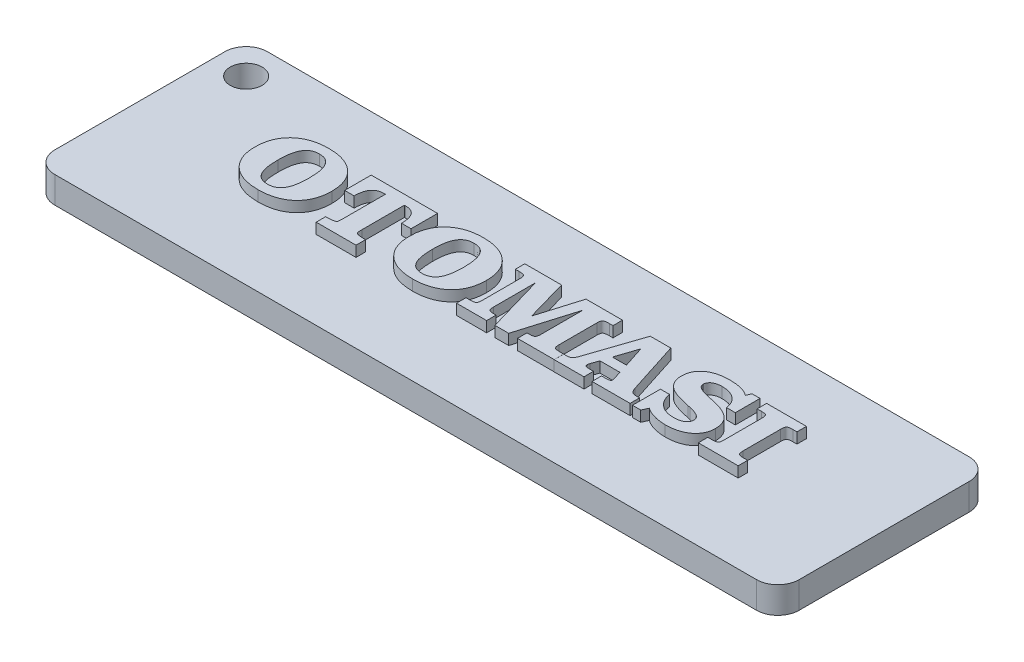
from build123d import *

# Parameters (mm, degrees)
SKETCH1_R           = 1.5
BOSS_EXTRUDE1_DEPTH = 2.5
BOSS_EXTRUDE2_DEPTH = 1


# Read off the part's stored shape, not the designer's step: Boss-Extrude2
with BuildPart() as part:
    # Sketch1 → Boss-Extrude1 (new body)
    with BuildSketch(Plane(origin=(0, 0, 0), x_dir=(1, 0, 0), z_dir=(0, 1, 0))):
        with BuildLine():
            Line((2, 0), (68, 0))
            ThreePointArc((68, 0), (69.414213562, 0.585786438), (70, 2))
            Line((70, 2), (70, 18))
            ThreePointArc((70, 18), (69.414213562, 19.414213562), (68, 20))
            Line((68, 20), (2, 20))
            ThreePointArc((2, 20), (0.585786438, 19.414213562), (0, 18))
            Line((0, 18), (0, 2))
            ThreePointArc((0, 2), (0.585786438, 0.585786438), (2, 0))
        make_face()
        with Locations(Location((3, 17, 0), (0, 0, 270))):
            Circle(SKETCH1_R, mode=Mode.SUBTRACT)
    extrude(amount=BOSS_EXTRUDE1_DEPTH)

    # Boss-Extrude2 outline → Boss-Extrude2 (add)
    # profile 1 of 7: a face of its own
    with BuildSketch(Plane(origin=(0, 2.5, 0), x_dir=(1, 0, 0), z_dir=(0, 1, 0))):
        with BuildLine():
            add(Edge.make_bspline(
                [(13.786930514, 7.318180924), (13.649802223, 7.320719924), (13.382310397, 7.325672672), (12.99274772, 7.368091793), (12.625803226, 7.437144678), (12.28129917, 7.53438664), (11.959554606, 7.660407631), (11.658986785, 7.811763921), (11.38292109, 7.994590031), (11.130872946, 8.203580663), (10.903786646, 8.436124447), (10.708596373, 8.693047109), (10.540506944, 8.969238893), (10.406138537, 9.267900687), (10.299250251, 9.586060568), (10.224796832, 9.925186783), (10.179646328, 10.284904318), (10.173964081, 10.531695195), (10.171052157, 10.658165672)],
                knots=[0, 0, 0, 0, 0.073749299, 0.143860428, 0.210503597, 0.274407664, 0.336117077, 0.396122131, 0.455094583, 0.513829434, 0.571961739, 0.629530751, 0.687035205, 0.745512812, 0.805324045, 0.867275774, 0.93198413, 1, 1, 1, 1], degree=3))
            add(Edge.make_bspline(
                [(17.394448458, 10.658165672), (17.391552518, 10.531231476), (17.385911539, 10.283977343), (17.340656321, 9.923324408), (17.266034008, 9.583991521), (17.161145628, 9.264817279), (17.026192845, 8.966553838), (16.858822394, 8.690331526), (16.662623515, 8.435051613), (16.43747285, 8.202301419), (16.18710719, 7.992450552), (15.910035696, 7.812825565), (15.612377335, 7.658189243), (15.290372267, 7.534699861), (14.946726976, 7.436999778), (14.58015267, 7.368254618), (14.191100181, 7.325587537), (13.92406269, 7.32069394), (13.786930514, 7.318180924)],
                knots=[0, 0, 0, 0, 0.068331593, 0.133102578, 0.195358385, 0.255148577, 0.313682782, 0.371242893, 0.42866919, 0.486683902, 0.545283253, 0.604175403, 0.664130134, 0.725575403, 0.78954132, 0.856248991, 0.926179321, 1, 1, 1, 1], degree=3))
            add(Edge.make_bspline(
                [(13.786930514, 14.006510832), (13.923599449, 14.004005939), (14.189712823, 13.999128565), (14.577819956, 13.956308658), (14.94348838, 13.887799281), (15.286938621, 13.790153464), (15.60781127, 13.664672009), (15.906392474, 13.510863804), (16.18265614, 13.328856513), (16.434607963, 13.119678684), (16.661717109, 12.887183494), (16.856911008, 12.630251301), (17.024963287, 12.35404965), (17.159661456, 12.055035464), (17.266193124, 11.735804014), (17.34085597, 11.394872343), (17.385763071, 11.033266603), (17.391509397, 10.785096653), (17.394448458, 10.658165672)],
                knots=[0, 0, 0, 0, 0.073507035, 0.143128393, 0.209778313, 0.273448551, 0.334931585, 0.394834411, 0.453812837, 0.512553638, 0.570691833, 0.628266677, 0.685776956, 0.744260487, 0.804314784, 0.866516694, 0.931727564, 1, 1, 1, 1], degree=3))
            add(Edge.make_bspline(
                [(10.171052157, 10.658165672), (10.173978074, 10.785096617), (10.179688072, 11.032805443), (10.224597118, 11.393506817), (10.299555265, 11.733413009), (10.405727295, 12.052313429), (10.54103736, 12.351408308), (10.707616681, 12.628615438), (10.904798862, 12.884463505), (11.130313326, 13.118354924), (11.38290146, 13.327445624), (11.659729167, 13.509597649), (11.958744058, 13.664941675), (12.281415659, 13.790076774), (12.62577011, 13.887611992), (12.992757214, 13.956581352), (13.382307826, 13.999024123), (13.649801352, 14.00397354), (13.786930514, 14.006510832)],
                knots=[0, 0, 0, 0, 0.068186534, 0.13306768, 0.194947727, 0.254926463, 0.313336408, 0.370988088, 0.428292477, 0.48653691, 0.545203802, 0.60410802, 0.664271826, 0.725909839, 0.789739965, 0.856306025, 0.926336032, 1, 1, 1, 1], degree=3))
        make_face()
        with BuildLine():
            add(Edge.make_bspline(
                [(13.785537111, 13.114733511), (13.723675316, 13.112715037), (13.603545379, 13.108795347), (13.429294201, 13.082664123), (13.268143536, 13.03676091), (13.12004326, 12.972048391), (12.984410603, 12.889258218), (12.863054495, 12.786658469), (12.754087049, 12.666419771), (12.659001855, 12.526960494), (12.576837775, 12.366914808), (12.504211679, 12.187103212), (12.445817327, 11.985019849), (12.394782272, 11.762884694), (12.358862575, 11.518153235), (12.330904599, 11.252291634), (12.314250278, 10.964459985), (12.31231882, 10.765479369), (12.311317727, 10.662345878)],
                knots=[0, 0, 0, 0, 0.05712815, 0.110937632, 0.16225665, 0.21142799, 0.259761507, 0.308476094, 0.35767175, 0.409189365, 0.463868863, 0.523528719, 0.587991329, 0.657919281, 0.733872173, 0.816247885, 0.904759581, 1, 1, 1, 1], degree=3))
            add(Edge.make_bspline(
                [(15.254182887, 10.662345878), (15.253181796, 10.765479371), (15.25125034, 10.96445999), (15.234596002, 11.252291619), (15.206638083, 11.518153288), (15.170718199, 11.76288452), (15.119683762, 11.985020423), (15.061287365, 12.18710131), (14.988668045, 12.36692111), (14.906481511, 12.526939612), (14.811472844, 12.666491539), (14.702476013, 12.786141475), (14.582417445, 12.889743712), (14.447090151, 12.971616076), (14.300222699, 13.036820955), (14.139958179, 13.082826064), (13.966591605, 13.108696113), (13.846931827, 13.112686258), (13.785537111, 13.114733511)],
                knots=[0, 0, 0, 0, 0.095389312, 0.184039383, 0.266543876, 0.342615508, 0.412652782, 0.477216169, 0.536969294, 0.591734275, 0.643332429, 0.692604995, 0.741067421, 0.789476499, 0.838331509, 0.889317948, 0.943211553, 1, 1, 1, 1], degree=3))
            add(Edge.make_bspline(
                [(13.785537111, 8.209958245), (13.846931827, 8.212005498), (13.966591605, 8.215995643), (14.139958179, 8.241865692), (14.300222699, 8.287870802), (14.447090151, 8.35307568), (14.582417445, 8.434948044), (14.702476013, 8.538550281), (14.811472844, 8.658200217), (14.906481511, 8.797752144), (14.988668045, 8.957770646), (15.061287365, 9.137590446), (15.119683762, 9.339671333), (15.170718199, 9.561807236), (15.206638083, 9.806538468), (15.234596002, 10.072400137), (15.25125034, 10.360231767), (15.253181796, 10.559212385), (15.254182887, 10.662345878)],
                knots=[0, 0, 0, 0, 0.056788447, 0.110682052, 0.161668491, 0.210523501, 0.258932579, 0.307395005, 0.356667571, 0.408265725, 0.463030706, 0.522783831, 0.587347218, 0.657384492, 0.733456124, 0.815960617, 0.904610688, 1, 1, 1, 1], degree=3))
            add(Edge.make_bspline(
                [(12.311317727, 10.662345878), (12.31231882, 10.559212387), (12.314250278, 10.360231771), (12.330904599, 10.072400122), (12.358862575, 9.806538521), (12.394782272, 9.561807062), (12.445817327, 9.339671907), (12.504211679, 9.137588544), (12.576837775, 8.957776948), (12.659001855, 8.797731262), (12.754087049, 8.658271985), (12.863054495, 8.538033287), (12.984410603, 8.435433538), (13.12004326, 8.352643365), (13.268143536, 8.287930847), (13.429294201, 8.242027633), (13.603545379, 8.215896409), (13.723675316, 8.211976719), (13.785537111, 8.209958245)],
                knots=[0, 0, 0, 0, 0.095240419, 0.183752115, 0.266127827, 0.342080719, 0.412008671, 0.476471281, 0.536131137, 0.590810635, 0.64232825, 0.691523906, 0.740238493, 0.78857201, 0.83774335, 0.889062368, 0.94287185, 1, 1, 1, 1], degree=3))
        make_face(mode=Mode.SUBTRACT)
    # profile 2 of 7: a face of its own
    with BuildSketch(Plane(origin=(0, 2.5, 0), x_dir=(1, 0, 0), z_dir=(0, 1, 0))):
        with BuildLine():
            add(Edge.make_bspline(
                [(20.069780421, 12.936378047), (20.018609058, 12.935652352), (19.919114042, 12.934241347), (19.775157074, 12.913431467), (19.640827625, 12.88392484), (19.516852394, 12.840350761), (19.403762361, 12.78450621), (19.299948455, 12.717155229), (19.208185899, 12.635404348), (19.125064672, 12.542660202), (19.051679476, 12.437316313), (18.990979751, 12.317102687), (18.937979967, 12.184771234), (18.895175812, 12.039147125), (18.861664993, 11.880751877), (18.839154274, 11.709286241), (18.822632148, 11.524716445), (18.821749097, 11.397174279), (18.821292172, 11.331178869)],
                knots=[0, 0, 0, 0, 0.065836888, 0.128009921, 0.186918091, 0.242723212, 0.296756494, 0.349012631, 0.401565728, 0.45451556, 0.509102166, 0.56635027, 0.62754898, 0.692458291, 0.761553662, 0.835821997, 0.915047745, 1, 1, 1, 1], degree=3))
            Line((20.069780421, 12.936378047), (20.158958154, 12.936378047))
            Line((20.158958154, 12.936378047), (20.158958154, 8.930347112))
            add(Edge.make_bspline(
                [(20.015437741, 8.385526905), (20.028456477, 8.390793815), (20.054392067, 8.401286418), (20.085357892, 8.431382321), (20.111453264, 8.468330963), (20.129805419, 8.518593116), (20.143681015, 8.586463375), (20.151581396, 8.678012561), (20.159354666, 8.795523396), (20.159098914, 8.882485331), (20.158958154, 8.930347112)],
                knots=[0, 0, 0, 0, 0.070115796, 0.139682886, 0.213673683, 0.296662204, 0.406806644, 0.562099208, 0.758989816, 1, 1, 1, 1], degree=3))
            add(Edge.make_bspline(
                [(19.1780031, 8.299135977), (19.267202561, 8.300356706), (19.432254564, 8.302615506), (19.661304639, 8.314848724), (19.852668509, 8.340015463), (19.965048856, 8.371437812), (20.015437741, 8.385526905)],
                knots=[0, 0, 0, 0, 0.316723171, 0.586055041, 0.814396151, 1, 1, 1, 1], degree=3))
            Line((19.1780031, 8.299135977), (19.1780031, 7.407358656))
            Line((19.1780031, 7.407358656), (22.923467849, 7.407358656))
            Line((22.923467849, 7.407358656), (22.923467849, 8.299135977))
            add(Edge.make_bspline(
                [(22.091606817, 8.385526905), (22.128482749, 8.372813318), (22.212156751, 8.343965322), (22.332694716, 8.32776788), (22.456993677, 8.317270717), (22.585324152, 8.311186393), (22.744125783, 8.303709647), (22.860289836, 8.300747174), (22.923467849, 8.299135977)],
                knots=[0, 0, 0, 0, 0.139056308, 0.31552823, 0.432089724, 0.584950407, 0.774267444, 1, 1, 1, 1], degree=3))
            add(Edge.make_bspline(
                [(21.942512796, 8.938707525), (21.942308363, 8.889450032), (21.941937798, 8.800163208), (21.950306939, 8.680399066), (21.956480851, 8.587432245), (21.969672766, 8.518678556), (21.990092255, 8.468177939), (22.017554308, 8.431294658), (22.050251548, 8.40084117), (22.077631018, 8.390702281), (22.091606817, 8.385526905)],
                knots=[0, 0, 0, 0, 0.242693935, 0.43992029, 0.591647998, 0.701661426, 0.783731589, 0.857458003, 0.92723971, 1, 1, 1, 1], degree=3))
            Line((21.942512796, 8.938707525), (21.942512796, 12.936378047))
            Line((21.942512796, 12.936378047), (22.037264136, 12.936378047))
            add(Edge.make_bspline(
                [(23.280178778, 11.331178869), (23.279686182, 11.397169316), (23.278730741, 11.525164918), (23.262595505, 11.710260957), (23.239118331, 11.882374289), (23.208276001, 12.041678328), (23.16505684, 12.187185872), (23.111641399, 12.318868428), (23.051083872, 12.438345069), (22.979153108, 12.5438693), (22.897956808, 12.637346703), (22.804748717, 12.7168785), (22.702656072, 12.785704937), (22.590109743, 12.842353691), (22.465895337, 12.883449053), (22.331937525, 12.91357867), (22.187916844, 12.934201131), (22.088430857, 12.935638693), (22.037264136, 12.936378047)],
                knots=[0, 0, 0, 0, 0.085039263, 0.164942837, 0.239287238, 0.308918278, 0.37389407, 0.434599956, 0.491906694, 0.546210291, 0.598817214, 0.65103084, 0.703671823, 0.75722426, 0.812890466, 0.87185897, 0.934095681, 1, 1, 1, 1], degree=3))
            Line((23.280178778, 11.331178869), (24.171956099, 11.331178869))
            Line((24.171956099, 11.331178869), (24.171956099, 13.828155368))
            Line((24.171956099, 13.828155368), (17.929514851, 13.828155368))
            Line((17.929514851, 13.828155368), (17.929514851, 11.331178869))
            Line((17.929514851, 11.331178869), (18.821292172, 11.331178869))
        make_face()
    # profile 3 of 7: a face of its own
    with BuildSketch(Plane(origin=(0, 2.5, 0), x_dir=(1, 0, 0), z_dir=(0, 1, 0))):
        with BuildLine():
            add(Edge.make_bspline(
                [(28.322900848, 7.318180924), (28.185772557, 7.320719924), (27.918280731, 7.325672672), (27.528718055, 7.368091793), (27.16177356, 7.437144678), (26.817269505, 7.53438664), (26.495524941, 7.660407631), (26.19495712, 7.811763921), (25.918891425, 7.994590031), (25.666843281, 8.203580663), (25.43975698, 8.436124447), (25.244566708, 8.693047109), (25.076477279, 8.969238893), (24.942108871, 9.267900687), (24.835220586, 9.586060568), (24.760767166, 9.925186783), (24.715616663, 10.284904318), (24.709934416, 10.531695195), (24.707022491, 10.658165672)],
                knots=[0, 0, 0, 0, 0.073749299, 0.143860428, 0.210503597, 0.274407664, 0.336117077, 0.396122131, 0.455094583, 0.513829434, 0.571961739, 0.629530751, 0.687035205, 0.745512812, 0.805324045, 0.867275774, 0.93198413, 1, 1, 1, 1], degree=3))
            add(Edge.make_bspline(
                [(31.930418793, 10.658165672), (31.927522853, 10.531231476), (31.921881874, 10.283977343), (31.876626655, 9.923324408), (31.802004343, 9.583991521), (31.697115962, 9.264817279), (31.56216318, 8.966553838), (31.394792728, 8.690331526), (31.19859385, 8.435051613), (30.973443184, 8.202301419), (30.723077524, 7.992450552), (30.44600603, 7.812825565), (30.14834767, 7.658189243), (29.826342601, 7.534699861), (29.48269731, 7.436999778), (29.116123004, 7.368254618), (28.727070516, 7.325587537), (28.460033025, 7.32069394), (28.322900848, 7.318180924)],
                knots=[0, 0, 0, 0, 0.068331593, 0.133102578, 0.195358385, 0.255148577, 0.313682782, 0.371242893, 0.42866919, 0.486683902, 0.545283253, 0.604175403, 0.664130134, 0.725575403, 0.78954132, 0.856248991, 0.926179321, 1, 1, 1, 1], degree=3))
            add(Edge.make_bspline(
                [(28.322900848, 14.006510832), (28.459569783, 14.004005939), (28.725683157, 13.999128565), (29.113790291, 13.956308658), (29.479458714, 13.887799281), (29.822908956, 13.790153464), (30.143781604, 13.664672009), (30.442362808, 13.510863804), (30.718626474, 13.328856513), (30.970578297, 13.119678684), (31.197687444, 12.887183494), (31.392881343, 12.630251301), (31.560933622, 12.35404965), (31.69563179, 12.055035464), (31.802163459, 11.735804014), (31.876826305, 11.394872343), (31.921733406, 11.033266603), (31.927479731, 10.785096653), (31.930418793, 10.658165672)],
                knots=[0, 0, 0, 0, 0.073507035, 0.143128393, 0.209778313, 0.273448551, 0.334931585, 0.394834411, 0.453812837, 0.512553638, 0.570691833, 0.628266677, 0.685776956, 0.744260487, 0.804314784, 0.866516694, 0.931727564, 1, 1, 1, 1], degree=3))
            add(Edge.make_bspline(
                [(24.707022491, 10.658165672), (24.709948408, 10.785096617), (24.715658407, 11.032805443), (24.760567452, 11.393506817), (24.8355256, 11.733413009), (24.941697629, 12.052313429), (25.077007694, 12.351408308), (25.243587016, 12.628615438), (25.440769197, 12.884463505), (25.66628366, 13.118354924), (25.918871795, 13.327445624), (26.195699502, 13.509597649), (26.494714392, 13.664941675), (26.817385993, 13.790076774), (27.161740444, 13.887611992), (27.528727549, 13.956581352), (27.918278161, 13.999024123), (28.185771686, 14.00397354), (28.322900848, 14.006510832)],
                knots=[0, 0, 0, 0, 0.068186534, 0.13306768, 0.194947727, 0.254926463, 0.313336408, 0.370988088, 0.428292477, 0.48653691, 0.545203802, 0.60410802, 0.664271826, 0.725909839, 0.789739965, 0.856306025, 0.926336032, 1, 1, 1, 1], degree=3))
        make_face()
        with BuildLine():
            add(Edge.make_bspline(
                [(28.321507446, 13.114733511), (28.259645651, 13.112715037), (28.139515714, 13.108795347), (27.965264535, 13.082664123), (27.804113871, 13.03676091), (27.656013595, 12.972048391), (27.520380938, 12.889258218), (27.39902483, 12.786658469), (27.290057384, 12.666419771), (27.19497219, 12.526960494), (27.112808109, 12.366914808), (27.040182014, 12.187103212), (26.981787661, 11.985019849), (26.930752607, 11.762884694), (26.89483291, 11.518153235), (26.866874934, 11.252291634), (26.850220613, 10.964459985), (26.848289155, 10.765479369), (26.847288062, 10.662345878)],
                knots=[0, 0, 0, 0, 0.05712815, 0.110937632, 0.16225665, 0.21142799, 0.259761507, 0.308476094, 0.35767175, 0.409189365, 0.463868863, 0.523528719, 0.587991329, 0.657919281, 0.733872173, 0.816247885, 0.904759581, 1, 1, 1, 1], degree=3))
            add(Edge.make_bspline(
                [(29.790153222, 10.662345878), (29.789152131, 10.765479371), (29.787220675, 10.96445999), (29.770566337, 11.252291619), (29.742608417, 11.518153288), (29.706688534, 11.76288452), (29.655654097, 11.985020423), (29.597257699, 12.18710131), (29.52463838, 12.36692111), (29.442451846, 12.526939612), (29.347443179, 12.666491539), (29.238446347, 12.786141475), (29.118387779, 12.889743712), (28.983060485, 12.971616076), (28.836193034, 13.036820955), (28.675928514, 13.082826064), (28.50256194, 13.108696113), (28.382902161, 13.112686258), (28.321507446, 13.114733511)],
                knots=[0, 0, 0, 0, 0.095389312, 0.184039383, 0.266543876, 0.342615508, 0.412652782, 0.477216169, 0.536969294, 0.591734275, 0.643332429, 0.692604995, 0.741067421, 0.789476499, 0.838331509, 0.889317948, 0.943211553, 1, 1, 1, 1], degree=3))
            add(Edge.make_bspline(
                [(28.321507446, 8.209958245), (28.382902161, 8.212005498), (28.50256194, 8.215995643), (28.675928514, 8.241865692), (28.836193034, 8.287870802), (28.983060485, 8.35307568), (29.118387779, 8.434948044), (29.238446347, 8.538550281), (29.347443179, 8.658200217), (29.442451846, 8.797752144), (29.52463838, 8.957770646), (29.597257699, 9.137590446), (29.655654097, 9.339671333), (29.706688534, 9.561807236), (29.742608417, 9.806538468), (29.770566337, 10.072400137), (29.787220675, 10.360231767), (29.789152131, 10.559212385), (29.790153222, 10.662345878)],
                knots=[0, 0, 0, 0, 0.056788447, 0.110682052, 0.161668491, 0.210523501, 0.258932579, 0.307395005, 0.356667571, 0.408265725, 0.463030706, 0.522783831, 0.587347218, 0.657384492, 0.733456124, 0.815960617, 0.904610688, 1, 1, 1, 1], degree=3))
            add(Edge.make_bspline(
                [(26.847288062, 10.662345878), (26.848289155, 10.559212387), (26.850220613, 10.360231771), (26.866874934, 10.072400122), (26.89483291, 9.806538521), (26.930752607, 9.561807062), (26.981787661, 9.339671907), (27.040182014, 9.137588544), (27.112808109, 8.957776948), (27.19497219, 8.797731262), (27.290057384, 8.658271985), (27.39902483, 8.538033287), (27.520380938, 8.435433538), (27.656013595, 8.352643365), (27.804113871, 8.287930847), (27.965264535, 8.242027633), (28.139515714, 8.215896409), (28.259645651, 8.211976719), (28.321507446, 8.209958245)],
                knots=[0, 0, 0, 0, 0.095240419, 0.183752115, 0.266127827, 0.342080719, 0.412008671, 0.476471281, 0.536131137, 0.590810635, 0.64232825, 0.691523906, 0.740238493, 0.78857201, 0.83774335, 0.889062368, 0.94287185, 1, 1, 1, 1], degree=3))
        make_face(mode=Mode.SUBTRACT)
    # profile 4 of 7: a face of its own
    with BuildSketch(Plane(origin=(0, 2.5, 0), x_dir=(1, 0, 0), z_dir=(0, 1, 0))):
        with BuildLine():
            add(Edge.make_bspline(
                [(38.299659629, 8.299135977), (38.35632539, 8.300087946), (38.459285714, 8.301817651), (38.59794517, 8.316231258), (38.70268577, 8.344553147), (38.784510043, 8.383784432), (38.834310884, 8.458581734), (38.864945843, 8.558355454), (38.88307591, 8.69053959), (38.885135388, 8.789092068), (38.886281898, 8.843956184)],
                knots=[0, 0, 0, 0, 0.174885189, 0.317762178, 0.427969558, 0.51007302, 0.590023155, 0.696044086, 0.830787893, 1, 1, 1, 1], degree=3))
            Line((38.299659629, 8.299135977), (38.107370144, 8.299135977))
            Line((38.107370144, 8.299135977), (38.107370144, 7.407358656))
            Line((38.107370144, 7.407358656), (41.561613861, 7.407358656))
            Line((41.561613861, 7.407358656), (41.561613861, 8.299135977))
            Line((41.561613861, 8.299135977), (41.213263345, 8.299135977))
            add(Edge.make_bspline(
                [(40.580658808, 8.843956184), (40.581484146, 8.789962164), (40.582980277, 8.692084612), (40.604901535, 8.561618234), (40.636848249, 8.460899299), (40.691490042, 8.386063716), (40.778903609, 8.345348304), (40.892078302, 8.318253195), (41.04095787, 8.301049685), (41.151915759, 8.299817333), (41.213263345, 8.299135977)],
                knots=[0, 0, 0, 0, 0.160118701, 0.290254855, 0.391462701, 0.472016405, 0.556544601, 0.670606554, 0.817881424, 1, 1, 1, 1], degree=3))
            Line((40.580658808, 8.843956184), (40.580658808, 12.39155784))
            add(Edge.make_bspline(
                [(41.213263345, 12.936378047), (41.151897649, 12.935725242), (41.040907004, 12.93454453), (40.892222614, 12.917033316), (40.778320533, 12.890692105), (40.692387852, 12.847868785), (40.636312575, 12.774664388), (40.60506511, 12.673742227), (40.582923037, 12.543483148), (40.581463796, 12.445570964), (40.580658808, 12.39155784)],
                knots=[0, 0, 0, 0, 0.182195159, 0.32953196, 0.443641877, 0.528867027, 0.608372684, 0.709623089, 0.839813967, 1, 1, 1, 1], degree=3))
            Line((41.213263345, 12.936378047), (41.561613861, 12.936378047))
            Line((41.561613861, 12.936378047), (41.561613861, 13.828155368))
            Line((41.561613861, 13.828155368), (38.135238185, 13.828155368))
            Line((38.135238185, 13.828155368), (36.952239832, 9.890401134))
            Line((36.952239832, 9.890401134), (35.830551171, 13.828155368))
            Line((35.830551171, 13.828155368), (32.376307453, 13.828155368))
            Line((32.376307453, 13.828155368), (32.376307453, 12.936378047))
            Line((32.376307453, 12.936378047), (32.714904155, 12.936378047))
            add(Edge.make_bspline(
                [(33.357262506, 12.39155784), (33.356171808, 12.445508515), (33.35419619, 12.543231105), (33.335154862, 12.674252624), (33.301300519, 12.774397473), (33.245635498, 12.847894361), (33.159163891, 12.890930319), (33.043378968, 12.91719683), (32.891418124, 12.934477302), (32.777658589, 12.935702292), (32.714904155, 12.936378047)],
                knots=[0, 0, 0, 0, 0.158626357, 0.287325013, 0.388063161, 0.466794699, 0.551190042, 0.665510867, 0.815482051, 1, 1, 1, 1], degree=3))
            Line((33.357262506, 12.39155784), (33.357262506, 8.843956184))
            add(Edge.make_bspline(
                [(32.714904155, 8.299135977), (32.777639896, 8.299841199), (32.891365545, 8.301119605), (33.043528189, 8.318081968), (33.15857629, 8.345117793), (33.246532411, 8.386039181), (33.300756628, 8.461170127), (33.335317247, 8.56110833), (33.35413938, 8.69233647), (33.3561516, 8.790024557), (33.357262506, 8.843956184)],
                knots=[0, 0, 0, 0, 0.184441145, 0.334349904, 0.448623144, 0.532328661, 0.612098368, 0.712794585, 0.84143967, 1, 1, 1, 1], degree=3))
            Line((32.714904155, 8.299135977), (32.376307453, 8.299135977))
            Line((32.376307453, 8.299135977), (32.376307453, 7.407358656))
            Line((32.376307453, 7.407358656), (35.206307046, 7.407358656))
            Line((35.206307046, 7.407358656), (35.206307046, 8.299135977))
            Line((35.206307046, 8.299135977), (35.023771375, 8.299135977))
            add(Edge.make_bspline(
                [(34.427395292, 8.843956184), (34.428626027, 8.790040864), (34.430853664, 8.692453849), (34.448313849, 8.561434882), (34.480118788, 8.462217201), (34.529110743, 8.386310104), (34.612139072, 8.345664616), (34.719123885, 8.317986664), (34.860299029, 8.301170288), (34.965683993, 8.299858838), (35.023771375, 8.299135977)],
                knots=[0, 0, 0, 0, 0.165096134, 0.298824879, 0.402703088, 0.483201973, 0.566624105, 0.677369851, 0.822168739, 1, 1, 1, 1], degree=3))
            Line((34.427395292, 8.843956184), (34.427395292, 12.77613681))
            Line((34.427395292, 12.77613681), (35.9852188, 7.407358656))
            Line((35.9852188, 7.407358656), (37.28108272, 7.407358656))
            Line((37.28108272, 7.407358656), (38.886281898, 12.767776397))
            Line((38.886281898, 12.767776397), (38.886281898, 8.843956184))
        make_face()
    # profile 5 of 7: a face of its own
    with BuildSketch(Plane(origin=(0, 2.5, 0), x_dir=(1, 0, 0), z_dir=(0, 1, 0))):
        with BuildLine():
            add(Edge.make_bspline(
                [(43.523523968, 8.515113297), (43.524038229, 8.49578595), (43.524999992, 8.459640271), (43.547020668, 8.411148018), (43.577466793, 8.370267516), (43.626200508, 8.340178162), (43.69496276, 8.322642657), (43.787180536, 8.307362463), (43.908022645, 8.30055266), (43.997748634, 8.299640934), (44.047443144, 8.299135977)],
                knots=[0, 0, 0, 0, 0.089991109, 0.168299851, 0.246088872, 0.326680095, 0.431719584, 0.577887558, 0.766214101, 1, 1, 1, 1], degree=3))
            add(Edge.make_bspline(
                [(43.570899638, 8.758958658), (43.564660862, 8.738113254), (43.551992854, 8.695786086), (43.536930253, 8.632174075), (43.527157238, 8.571581268), (43.524661236, 8.53278862), (43.523523968, 8.515113297)],
                knots=[0, 0, 0, 0, 0.262014008, 0.532026688, 0.786774566, 1, 1, 1, 1], degree=3))
            Line((43.570899638, 8.758958658), (43.816138401, 9.458446494))
            Line((43.816138401, 9.458446494), (45.680510363, 9.458446494))
            Line((45.680510363, 9.458446494), (45.931322735, 8.710189586))
            add(Edge.make_bspline(
                [(45.949436961, 8.643306287), (45.945593781, 8.656277247), (45.939029859, 8.67843087), (45.9335812, 8.700883136), (45.931322735, 8.710189586)],
                knots=[0, 0, 0, 0, 0.585500613, 1, 1, 1, 1], degree=3))
            add(Edge.make_bspline(
                [(45.982878611, 8.515113297), (45.980060958, 8.532870817), (45.973115002, 8.576645889), (45.958263749, 8.618456378), (45.949436961, 8.643306287)],
                knots=[0, 0, 0, 0, 0.405653705, 1, 1, 1, 1], degree=3))
            add(Edge.make_bspline(
                [(45.392076136, 8.299135977), (45.445491735, 8.299652618), (45.5431145, 8.300596836), (45.675456273, 8.307478834), (45.778888948, 8.322660994), (45.857141931, 8.340707314), (45.915221151, 8.369086607), (45.953434759, 8.409945303), (45.980620986, 8.458766851), (45.982099782, 8.495675057), (45.982878611, 8.515113297)],
                knots=[0, 0, 0, 0, 0.229987884, 0.420327643, 0.56992334, 0.67953675, 0.765402884, 0.843181626, 0.917409335, 1, 1, 1, 1], degree=3))
            Line((45.392076136, 8.299135977), (45.118969331, 8.299135977))
            Line((45.118969331, 8.299135977), (45.118969331, 7.407358656))
            Line((45.118969331, 7.407358656), (48.69583243, 7.407358656))
            Line((48.69583243, 7.407358656), (48.69583243, 8.299135977))
            Line((48.69583243, 8.299135977), (48.365596141, 8.299135977))
            add(Edge.make_bspline(
                [(47.699549954, 8.860677009), (47.7197197, 8.807911244), (47.756872847, 8.710715462), (47.81841857, 8.580527994), (47.883614821, 8.480781064), (47.95136777, 8.403846249), (48.034109161, 8.354848734), (48.12968753, 8.321475332), (48.242277214, 8.302934104), (48.32279905, 8.300454094), (48.365596141, 8.299135977)],
                knots=[0, 0, 0, 0, 0.177046884, 0.32612453, 0.450065384, 0.549952581, 0.644073371, 0.747667515, 0.865886113, 1, 1, 1, 1], degree=3))
            Line((47.699549954, 8.860677009), (46.105497993, 13.828155368))
            Line((46.105497993, 13.828155368), (44.175636134, 13.828155368))
            Line((44.175636134, 13.828155368), (42.509127265, 8.887151648))
            add(Edge.make_bspline(
                [(41.759476954, 8.299135977), (41.808778639, 8.299870216), (41.900344596, 8.301233887), (42.027125718, 8.319361021), (42.133224162, 8.34744969), (42.225128881, 8.390404993), (42.302618819, 8.46561459), (42.373447881, 8.573243736), (42.445584677, 8.716446803), (42.486637175, 8.826732841), (42.509127265, 8.887151648)],
                knots=[0, 0, 0, 0, 0.140086787, 0.260177331, 0.363034251, 0.45162504, 0.545082608, 0.665608053, 0.816807614, 1, 1, 1, 1], degree=3))
            Line((41.759476954, 8.299135977), (41.571613861, 8.299135977))
            Line((41.571613861, 8.299135977), (41.561613861, 7.397358656))
            Line((41.561613861, 7.397358656), (44.363745412, 7.407358656))
            Line((44.363745412, 7.407358656), (44.363745412, 8.299135977))
            Line((44.363745412, 8.299135977), (44.047443144, 8.299135977))
        make_face()
        Polygon((44.760865001, 12.355329386), (45.411583765, 10.350223816), (44.094818814, 10.350223816), align=None, mode=Mode.SUBTRACT)
    # profile 6 of 7: a face of its own
    with BuildSketch(Plane(origin=(0, 2.5, 0), x_dir=(1, 0, 0), z_dir=(0, 1, 0))):
        with BuildLine():
            add(Edge.make_bspline(
                [(52.080406044, 7.318180924), (51.982327439, 7.319967893), (51.786616856, 7.323533693), (51.495486904, 7.355003828), (51.208418278, 7.407164671), (50.928388402, 7.47706674), (50.662148008, 7.564602951), (50.41722624, 7.668750178), (50.193412602, 7.782303977), (50.059564019, 7.874102328), (49.994483154, 7.918737213)],
                knots=[0, 0, 0, 0, 0.133505167, 0.266402381, 0.398134476, 0.530496495, 0.659080887, 0.779234373, 0.892657675, 1, 1, 1, 1], degree=3))
            add(Edge.make_bspline(
                [(54.759918214, 9.383202783), (54.757826687, 9.306449638), (54.753724283, 9.15590302), (54.720046151, 8.935976015), (54.662404265, 8.728073512), (54.582927284, 8.531860304), (54.480402995, 8.347964532), (54.355350079, 8.176832646), (54.207335309, 8.018082097), (54.037702191, 7.873013624), (53.849562043, 7.741504719), (53.643409655, 7.629019048), (53.421968942, 7.532389271), (53.18464655, 7.453171621), (52.931063858, 7.391758985), (52.661648063, 7.349781921), (52.37638091, 7.322211465), (52.180798915, 7.319548059), (52.080406044, 7.318180924)],
                knots=[0, 0, 0, 0, 0.060472684, 0.118613486, 0.174832519, 0.230167406, 0.285065865, 0.340347448, 0.396815026, 0.455738827, 0.515958356, 0.577399438, 0.640513533, 0.7061506, 0.77433914, 0.845896441, 0.920898145, 1, 1, 1, 1], degree=3))
            add(Edge.make_bspline(
                [(52.676782128, 11.453798251), (52.763812735, 11.4307391), (52.933208579, 11.385856909), (53.177008888, 11.310086559), (53.402419611, 11.225313202), (53.608637409, 11.130993595), (53.799195013, 11.03378315), (53.96979387, 10.925191696), (54.123732373, 10.811949747), (54.259083135, 10.689570093), (54.377043324, 10.558435404), (54.480978681, 10.419925349), (54.566339277, 10.269521935), (54.63794064, 10.111220999), (54.69154344, 9.94211654), (54.733234862, 9.764892141), (54.754464586, 9.576934744), (54.758073429, 9.448736017), (54.759918214, 9.383202783)],
                knots=[0, 0, 0, 0, 0.084062763, 0.163619249, 0.238287644, 0.308745178, 0.375281473, 0.437849204, 0.497352225, 0.553540246, 0.607890556, 0.661843162, 0.714883381, 0.769046491, 0.823769281, 0.880266098, 0.938793856, 1, 1, 1, 1], degree=3))
            add(Edge.make_bspline(
                [(51.885329755, 11.625186704), (51.964287983, 11.608929561), (52.113909611, 11.578123141), (52.325130438, 11.534649509), (52.50955774, 11.491808239), (52.623824387, 11.465835509), (52.676782128, 11.453798251)],
                knots=[0, 0, 0, 0, 0.298637736, 0.56590257, 0.798814266, 1, 1, 1, 1], degree=3))
            add(Edge.make_bspline(
                [(50.568564805, 12.377623819), (50.572826028, 12.337360428), (50.581594745, 12.254506702), (50.650328228, 12.138364962), (50.757612947, 12.033641769), (50.904812281, 11.936360541), (51.092334123, 11.847058417), (51.320467578, 11.76495029), (51.588724844, 11.688630188), (51.782393527, 11.647204657), (51.885329755, 11.625186704)],
                knots=[0, 0, 0, 0, 0.074694932, 0.153706713, 0.24488555, 0.352657291, 0.480764576, 0.631076508, 0.803914644, 1, 1, 1, 1], degree=3))
            add(Edge.make_bspline(
                [(51.633123982, 13.114733511), (51.555368002, 13.112646352), (51.407209278, 13.108669413), (51.197766843, 13.070284149), (51.011942669, 13.010854661), (50.854692089, 12.922529592), (50.726762048, 12.814258913), (50.63373638, 12.68502717), (50.578455041, 12.536485344), (50.571918996, 12.431500381), (50.568564805, 12.377623819)],
                knots=[0, 0, 0, 0, 0.160745889, 0.306290345, 0.439114242, 0.562625524, 0.677095872, 0.783241559, 0.888763123, 1, 1, 1, 1], degree=3))
            add(Edge.make_bspline(
                [(53.572739655, 11.598712065), (53.56454442, 11.656507163), (53.548468287, 11.769880567), (53.506124371, 11.933687149), (53.450099147, 12.087416133), (53.382081453, 12.232244675), (53.298620998, 12.366351049), (53.204527403, 12.492765858), (53.094020885, 12.607529031), (52.971918167, 12.713096005), (52.838051322, 12.807941248), (52.69410348, 12.890026529), (52.5408836, 12.960450512), (52.378091725, 13.017467448), (52.204806771, 13.060101868), (52.022918326, 13.092607987), (51.830864364, 13.110165431), (51.700039231, 13.113187675), (51.633123982, 13.114733511)],
                knots=[0, 0, 0, 0, 0.064272495, 0.126079752, 0.185974259, 0.244340988, 0.302001338, 0.359722961, 0.417634802, 0.47713454, 0.537334299, 0.598075337, 0.65944041, 0.722880478, 0.78778945, 0.855849244, 0.926268878, 1, 1, 1, 1], degree=3))
            Line((53.572739655, 11.598712065), (54.403207285, 11.598712065))
            Line((54.403207285, 11.598712065), (54.403207285, 13.924300111))
            Line((54.403207285, 13.924300111), (53.652163573, 13.924300111))
            Line((53.652163573, 13.924300111), (53.471021304, 13.481198254))
            add(Edge.make_bspline(
                [(51.520258414, 14.006510832), (51.622014241, 14.004820453), (51.819774939, 14.00153523), (52.107634264, 13.978619766), (52.377003225, 13.936347273), (52.62936487, 13.880130717), (52.864384158, 13.8054928), (53.084102874, 13.717521411), (53.286862519, 13.609862137), (53.410049439, 13.523796694), (53.471021304, 13.481198254)],
                knots=[0, 0, 0, 0, 0.148556339, 0.28871669, 0.421158687, 0.546340231, 0.665792945, 0.780757854, 0.891485211, 1, 1, 1, 1], degree=3))
            add(Edge.make_bspline(
                [(48.874187894, 12.019519489), (48.876348058, 12.096264673), (48.880557279, 12.24580769), (48.912714589, 12.46330316), (48.967502944, 12.666951947), (49.04271217, 12.858271552), (49.140905252, 13.035997905), (49.260614464, 13.20083299), (49.402219336, 13.351692942), (49.565164134, 13.488796958), (49.747516349, 13.610950491), (49.948613939, 13.716982518), (50.166488159, 13.808246953), (50.403597302, 13.879651309), (50.657899784, 13.93651537), (50.929670087, 13.978463702), (51.21934333, 14.001565289), (51.418035892, 14.004830804), (51.520258414, 14.006510832)],
                knots=[0, 0, 0, 0, 0.061526213, 0.119887855, 0.175812228, 0.230312039, 0.284322226, 0.33818453, 0.393257832, 0.449816091, 0.508593393, 0.568908225, 0.631852042, 0.697708079, 0.76719246, 0.840674412, 0.918030835, 1, 1, 1, 1], degree=3))
            add(Edge.make_bspline(
                [(49.533267071, 10.681853507), (49.481635771, 10.723458439), (49.379564448, 10.805708362), (49.245782833, 10.9471309), (49.131523548, 11.100465185), (49.037894268, 11.265234995), (48.965392082, 11.440990295), (48.911790709, 11.625348112), (48.881037056, 11.819703453), (48.87650002, 11.952066), (48.874187894, 12.019519489)],
                knots=[0, 0, 0, 0, 0.128363745, 0.253765784, 0.375978822, 0.498095733, 0.619933777, 0.743550283, 0.86931025, 1, 1, 1, 1], degree=3))
            add(Edge.make_bspline(
                [(51.574601095, 9.955891031), (51.493318516, 9.974929767), (51.337667039, 10.011387855), (51.113477395, 10.063972634), (50.909615815, 10.115323367), (50.724887628, 10.164596288), (50.559080948, 10.209554359), (50.413656296, 10.254692928), (50.286773124, 10.294490045), (50.146773371, 10.345607991), (49.991986348, 10.410743142), (49.822970651, 10.494289975), (49.669862268, 10.582597784), (49.577803859, 10.649491234), (49.533267071, 10.681853507)],
                knots=[0, 0, 0, 0, 0.114752715, 0.219744868, 0.316523057, 0.403709538, 0.482551296, 0.552631746, 0.613000807, 0.665310203, 0.757442921, 0.843670401, 0.924369558, 1, 1, 1, 1], degree=3))
            add(Edge.make_bspline(
                [(51.871395735, 9.890401134), (51.840710266, 9.896764747), (51.78343484, 9.908642639), (51.70376669, 9.927288355), (51.635480272, 9.942574553), (51.593647377, 9.951724921), (51.574601095, 9.955891031)],
                knots=[0, 0, 0, 0, 0.309307146, 0.57733187, 0.807561581, 1, 1, 1, 1], degree=3))
            add(Edge.make_bspline(
                [(53.065541304, 9.066900514), (53.062358018, 9.11262663), (53.05595789, 9.204560891), (52.992538672, 9.334083543), (52.896589344, 9.452800858), (52.762834702, 9.561164918), (52.591764317, 9.65689225), (52.385109381, 9.745502586), (52.141804878, 9.826216789), (51.965142259, 9.868149449), (51.871395735, 9.890401134)],
                knots=[0, 0, 0, 0, 0.087706345, 0.176337259, 0.272629339, 0.380833153, 0.506108897, 0.649790909, 0.814160544, 1, 1, 1, 1], degree=3))
            add(Edge.make_bspline(
                [(51.871395735, 8.299135977), (51.959809526, 8.301112615), (52.127389303, 8.304859141), (52.363587378, 8.34402924), (52.570461405, 8.407117106), (52.720744139, 8.483153936), (52.821437882, 8.557954857), (52.887413198, 8.615684353), (52.942752052, 8.679414874), (52.987467371, 8.748014235), (53.022539505, 8.821087856), (53.048425112, 8.898651712), (53.061686622, 8.981453626), (53.064240445, 9.038064324), (53.065541304, 9.066900514)],
                knots=[0, 0, 0, 0, 0.167008799, 0.316549001, 0.450950387, 0.574653129, 0.632428536, 0.687770982, 0.740054938, 0.791439109, 0.842098034, 0.892908905, 0.945450255, 1, 1, 1, 1], degree=3))
            add(Edge.make_bspline(
                [(49.821701298, 9.993512887), (49.832519844, 9.93052783), (49.853823242, 9.806500454), (49.906937731, 9.628016208), (49.970452826, 9.458370757), (50.048722279, 9.298648262), (50.141813778, 9.149292881), (50.245557437, 9.007167455), (50.366742445, 8.877959434), (50.499025586, 8.758112931), (50.641570188, 8.649396594), (50.794368005, 8.556423848), (50.954030385, 8.475419348), (51.12274029, 8.412606771), (51.298650668, 8.361333627), (51.482454166, 8.326032732), (51.674317768, 8.302521281), (51.804904393, 8.300278131), (51.871395735, 8.299135977)],
                knots=[0, 0, 0, 0, 0.065679728, 0.129333602, 0.191176109, 0.251854362, 0.311914483, 0.372014492, 0.432528905, 0.493748261, 0.555472558, 0.616596773, 0.677487172, 0.739329679, 0.801474075, 0.865747027, 0.931641849, 1, 1, 1, 1], degree=3))
            Line((49.821701298, 9.993512887), (48.963365627, 9.993512887))
            Line((48.963365627, 9.993512887), (48.963365627, 7.368343398))
            Line((48.963365627, 7.368343398), (49.738097174, 7.368343398))
            Line((49.738097174, 7.368343398), (49.994483154, 7.918737213))
        make_face()
    # profile 7 of 7: a face of its own
    with BuildSketch(Plane(origin=(0, 2.5, 0), x_dir=(1, 0, 0), z_dir=(0, 1, 0))):
        with BuildLine():
            add(Edge.make_bspline(
                [(57.881138838, 8.843956184), (57.882350297, 8.790026808), (57.884543046, 8.69241435), (57.902211517, 8.561547274), (57.933546574, 8.461664828), (57.984348833, 8.386689859), (58.066753156, 8.345830838), (58.172424187, 8.318061692), (58.311229493, 8.301131191), (58.414776137, 8.299845674), (58.471941313, 8.299135977)],
                knots=[0, 0, 0, 0, 0.166125115, 0.300687339, 0.405212981, 0.487055858, 0.570997928, 0.681056791, 0.823920467, 1, 1, 1, 1], degree=3))
            Line((57.881138838, 8.843956184), (57.881138838, 12.39155784))
            add(Edge.make_bspline(
                [(58.471941313, 12.936378047), (58.414758635, 12.93569464), (58.311180288, 12.934456745), (58.172564062, 12.917242221), (58.06617147, 12.890160342), (57.985251297, 12.847284464), (57.93300196, 12.773881753), (57.902379301, 12.673815813), (57.884484079, 12.543152719), (57.882329313, 12.445506094), (57.881138838, 12.39155784)],
                knots=[0, 0, 0, 0, 0.176155235, 0.319080332, 0.429186513, 0.513881357, 0.594612806, 0.699183386, 0.833803463, 1, 1, 1, 1], degree=3))
            Line((58.471941313, 12.936378047), (58.862093891, 12.936378047))
            Line((58.862093891, 12.936378047), (58.862093891, 13.828155368))
            Line((58.862093891, 13.828155368), (55.116629142, 13.828155368))
            Line((55.116629142, 13.828155368), (55.116629142, 12.936378047))
            Line((55.116629142, 12.936378047), (55.510961927, 12.936378047))
            add(Edge.make_bspline(
                [(56.097584196, 12.39155784), (56.096436141, 12.446896456), (56.094372026, 12.54639113), (56.076271698, 12.679393433), (56.046094682, 12.779655748), (55.995247943, 12.853078123), (55.914270136, 12.892687796), (55.808917345, 12.918638584), (55.670660031, 12.933925865), (55.567653254, 12.935507545), (55.510961927, 12.936378047)],
                knots=[0, 0, 0, 0, 0.170419433, 0.306401333, 0.412283021, 0.490978871, 0.572974502, 0.682655156, 0.825344497, 1, 1, 1, 1], degree=3))
            Line((56.097584196, 12.39155784), (56.097584196, 8.843956184))
            add(Edge.make_bspline(
                [(55.510961927, 8.299135977), (55.567627688, 8.300087946), (55.670588012, 8.301817651), (55.809247468, 8.316231258), (55.913988068, 8.344553147), (55.995812341, 8.383784432), (56.045613182, 8.458581734), (56.076248141, 8.558355454), (56.094378209, 8.69053959), (56.096437686, 8.789092068), (56.097584196, 8.843956184)],
                knots=[0, 0, 0, 0, 0.174885189, 0.317762178, 0.427969558, 0.51007302, 0.590023155, 0.696044086, 0.830787893, 1, 1, 1, 1], degree=3))
            Line((55.510961927, 8.299135977), (55.116629142, 8.299135977))
            Line((55.116629142, 8.299135977), (55.116629142, 7.407358656))
            Line((55.116629142, 7.407358656), (58.862093891, 7.407358656))
            Line((58.862093891, 7.407358656), (58.862093891, 8.299135977))
            Line((58.862093891, 8.299135977), (58.471941313, 8.299135977))
        make_face()
    extrude(amount=BOSS_EXTRUDE2_DEPTH)


solid = part.part
